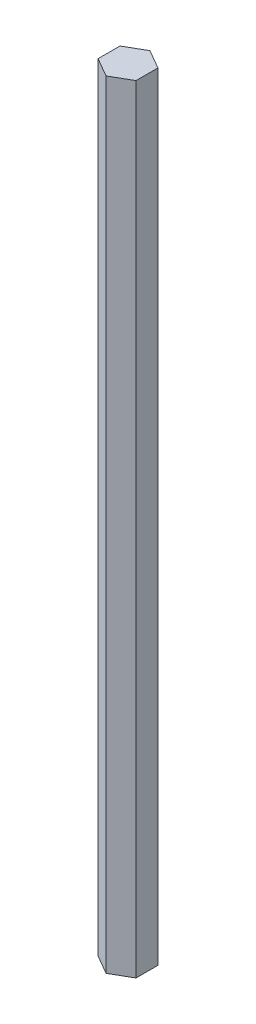
from build123d import *

# Parameters (mm, degrees)
BOSS_EXTRUDE1_DEPTH = 130


with BuildPart() as part:
    # Sketch1 → Boss-Extrude1 (new, symmetric)
    with BuildSketch(Plane(origin=(0, 0, 0), x_dir=(1, 0, 0), z_dir=(0, 1, 0))):
        Polygon((6.349472256, -3.667088137), (6.350527612, 3.665260206), (0.001055356, 7.332348343), (-6.349472256, 3.667088137), (-6.350527612, -3.665260206), (-0.001055356, -7.332348343), align=None)
    extrude(amount=BOSS_EXTRUDE1_DEPTH, both=True)


solid = part.part
